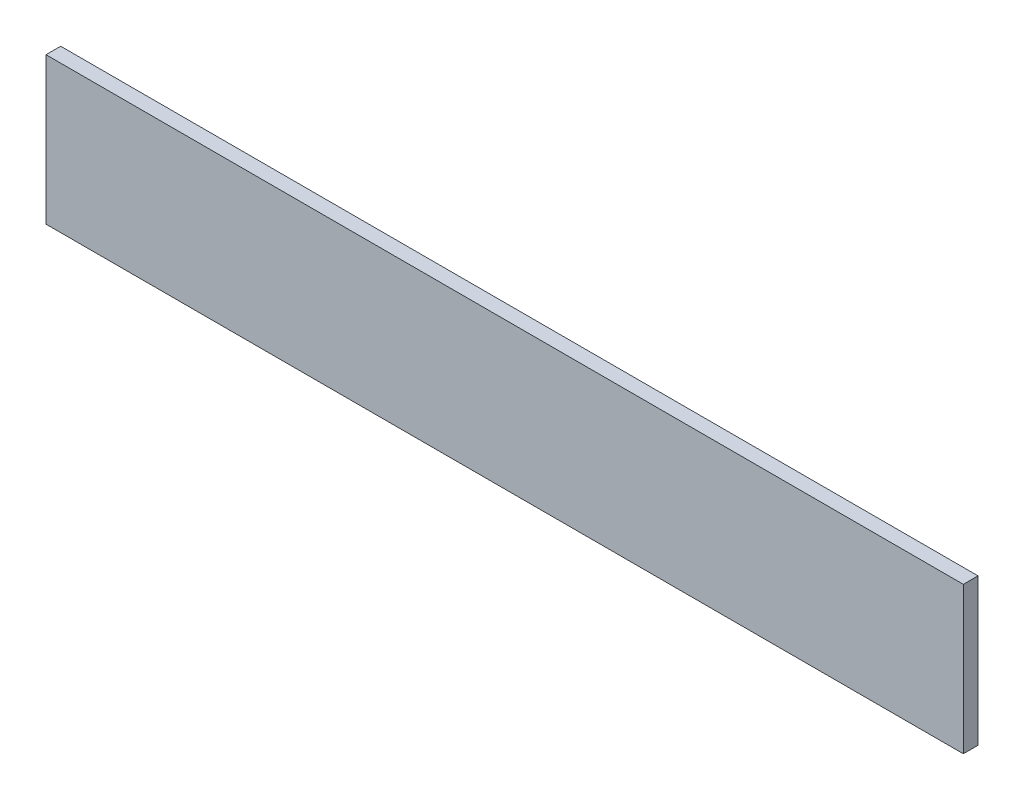
from build123d import *

# Parameters (mm, degrees)
SKETCH1_W           = 500
SKETCH1_H           = 80
BOSS_EXTRUDE1_DEPTH = 8


with BuildPart() as part:
    # Sketch1 → Boss-Extrude1 (new body)
    with BuildSketch(Plane.XY):
        Rectangle(SKETCH1_W, SKETCH1_H)
    extrude(amount=BOSS_EXTRUDE1_DEPTH)


solid = part.part
